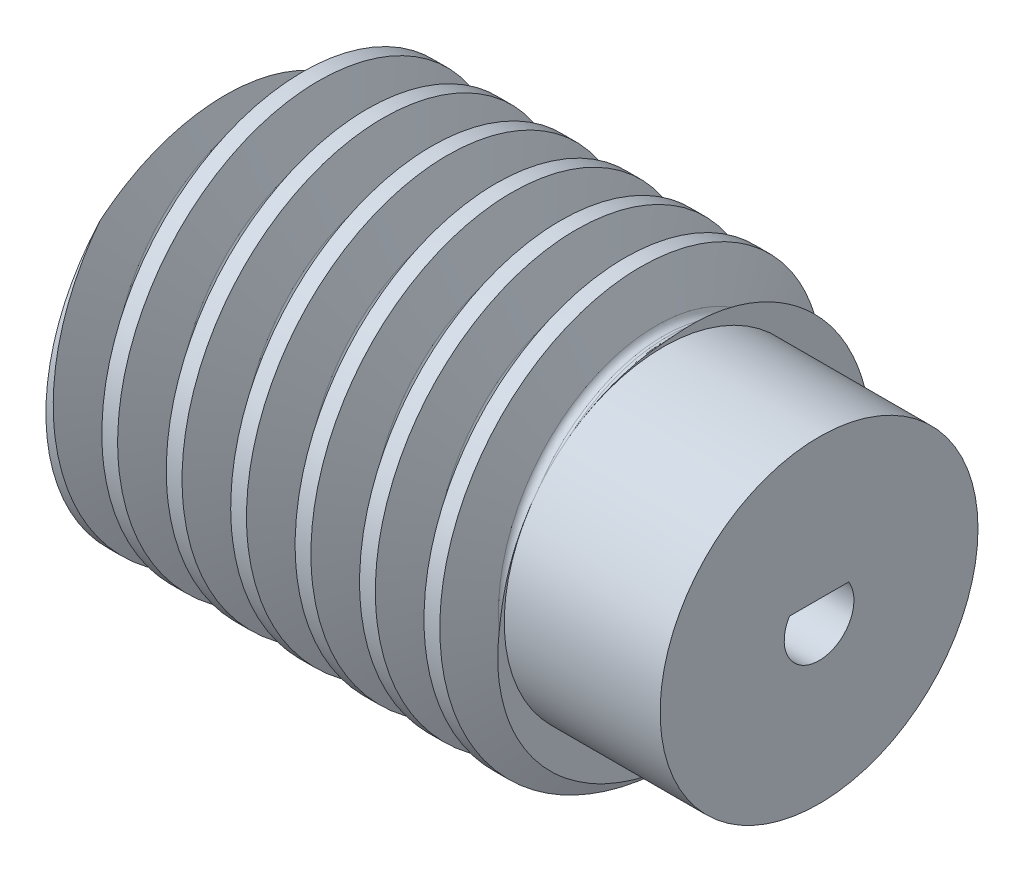
from build123d import *

# Parameters (mm, degrees)
SKETCH_1_W          = 20
SKETCH_1_H          = 10.1
SWEEP_1_PITCH       = 3.141592654
SKETCH_5_R          = 7.75
EXTRUDE_2_DEPTH     = 7.6
CUT_EXTRUDE_1_DEPTH = 20


with BuildPart() as part:
    # 草图1 → 旋转1 (revolve)
    with BuildSketch(Plane.XY, mode=Mode.PRIVATE) as revolve_1_sk:
        with Locations((10, 5.05)):
            Rectangle(SKETCH_1_W, SKETCH_1_H)
    revolve(revolve_1_sk.sketch.rotate(Axis((-56.849408284, 0, 0), (1, 0, 0)), 90), axis=Axis((-56.849408284, 0, 0), (1, 0, 0)))

    # 切除-扫描1: the profile of 草图3 profile screwed along a right-hand helix of 9.676621 turns, 10 arcs to a turn; built about Z, then put on its axis
    sweep_1_z = Axis((0, 0, 0), (0, 0, 1))
    sweep_1_corners = [(10.1003, 0, -3.557405454), (10.1003, 0, -1.18565623), (8.000032346, 0, -1.95009114), (7.75, 0, -2.307174336), (7.75, 0, -2.435887348), (8.000032346, 0, -2.792970544)]
    with BuildLine(mode=Mode.PRIVATE) as sweep_1_profile:
        Line(sweep_1_corners[0], sweep_1_corners[1])
        Line(sweep_1_corners[1], sweep_1_corners[2])
        Line(sweep_1_corners[3], sweep_1_corners[4])
        Line(sweep_1_corners[5], sweep_1_corners[0])
        ThreePointArc((8.000032346, 0, -1.95009114), (7.818722223, 0, -2.08921529), (7.75, 0, -2.307174336))
        ThreePointArc((7.75, 0, -2.435887348), (7.818722223, 0, -2.653846394), (8.000032346, 0, -2.792970544))
    sweep_1_cap = Face(sweep_1_profile.wire())
    sweep_1_arcs = [((8.000032346, 0, -1.95009114), (7.75, 0, -2.041095472), (7.75, 0, -2.307174336), (1, 0.8191520442889907, 1)), ((7.75, 0, -2.435887348), (7.75, 0, -2.701966213), (8.000032346, 0, -2.792970544), (1, 0.8191520442889931, 1))]  # start, shoulder, end, weights
    sweep_1_turn_angles = [0, 18, 36, 54, 72, 90, 108, 126, 144, 162, 180, 198, 216, 234, 252, 270, 288, 306, 324, 342, 360]
    sweep_1_turn_weights = [1, 0.9510565162951535, 1, 0.9510565162951535, 1, 0.9510565162951535, 1, 0.9510565162951535, 1, 0.9510565162951535, 1, 0.9510565162951535, 1, 0.9510565162951535, 1, 0.9510565162951535, 1, 0.9510565162951535, 1, 0.9510565162951535, 1]
    sweep_1_turn_rails = [Edge.make_bspline([Vector(p[0], p[1], 0).rotate(sweep_1_z, sweep_1_turn_angles[k]) / sweep_1_turn_weights[k] + Vector(0, 0, p[2] + SWEEP_1_PITCH * sweep_1_turn_angles[k] / 360) for k in range(21)], [0, 0, 0, 1, 1, 2, 2, 3, 3, 4, 4, 5, 5, 6, 6, 7, 7, 8, 8, 9, 9, 10, 10, 10], 2, sweep_1_turn_weights) for p in sweep_1_corners]
    sweep_1_turn_sides = [*[Face.make_surface_from_curves(sweep_1_turn_rails[p[0]], sweep_1_turn_rails[p[1]]) for p in [(0, 1), (1, 2), (3, 4), (5, 0)]], *[Face.make_bezier_surface([[Vector(p[j][0], p[j][1], 0).rotate(sweep_1_z, sweep_1_turn_angles[2 * i + k]) / sweep_1_turn_weights[2 * i + k] + Vector(0, 0, p[j][2] + SWEEP_1_PITCH * sweep_1_turn_angles[2 * i + k] / 360) for k in range(3)] for j in range(3)], [[p[3][j] * sweep_1_turn_weights[2 * i + k] for k in range(3)] for j in range(3)]) for p in sweep_1_arcs for i in range(10)]]
    sweep_1_last_angles = [3240, 3258, 3276, 3294, 3312, 3330, 3348, 3366, 3384, 3402, 3420, 3438, 3456, 3469.791697198, 3483.583394395]
    sweep_1_last_weights = [1, 0.9510565162951535, 1, 0.9510565162951535, 1, 0.9510565162951535, 1, 0.9510565162951535, 1, 0.9510565162951535, 1, 0.9510565162951535, 1, 0.9711688358913783, 1]
    sweep_1_last_rails = [Edge.make_bspline([Vector(p[0], p[1], 0).rotate(sweep_1_z, sweep_1_last_angles[k]) / sweep_1_last_weights[k] + Vector(0, 0, p[2] + SWEEP_1_PITCH * sweep_1_last_angles[k] / 360) for k in range(15)], [0, 0, 0, 1, 1, 2, 2, 3, 3, 4, 4, 5, 5, 6, 6, 7, 7, 7], 2, sweep_1_last_weights) for p in sweep_1_corners]
    sweep_1_last_sides = [*[Face.make_surface_from_curves(sweep_1_last_rails[p[0]], sweep_1_last_rails[p[1]]) for p in [(0, 1), (1, 2), (3, 4), (5, 0)]], *[Face.make_bezier_surface([[Vector(p[j][0], p[j][1], 0).rotate(sweep_1_z, sweep_1_last_angles[2 * i + k]) / sweep_1_last_weights[2 * i + k] + Vector(0, 0, p[j][2] + SWEEP_1_PITCH * sweep_1_last_angles[2 * i + k] / 360) for k in range(3)] for j in range(3)], [[p[3][j] * sweep_1_last_weights[2 * i + k] for k in range(3)] for j in range(3)]) for p in sweep_1_arcs for i in range(7)]]
    sweep_1 = Plane(origin=(0, 0, 0), x_dir=(0, 1, 0), z_dir=(1, 0, 0)) * Solid(Shell([*[p.moved(Location((0, 0, SWEEP_1_PITCH * i))) for i in range(9) for p in sweep_1_turn_sides], *sweep_1_last_sides, sweep_1_cap, sweep_1_cap.rotate(sweep_1_z, 3483.583394395).moved(Location((0, 0, SWEEP_1_PITCH * 3483.583394395 / 360)))]))
    add(sweep_1, mode=Mode.SUBTRACT)

    # 草图5 → 凸台-拉伸2 (add)
    with BuildSketch(Plane(origin=(20, 0, 0), x_dir=(0, 0, -1), z_dir=(1, 0, 0))):
        with Locations(Location((0, 0, 0), (0, 0, 141.011660332))):
            Circle(SKETCH_5_R)
    extrude(amount=EXTRUDE_2_DEPTH)

    # 草图6 → 切除-拉伸1 (cut)
    with BuildSketch(Plane(origin=(27.6, 0, 0), x_dir=(0, 0, -1), z_dir=(1, 0, 0))):
        with BuildLine():
            Line((-1.44222051, 0.9), (1.44222051, 0.9))
            ThreePointArc((1.44222051, 0.9), (0, -1.7), (-1.44222051, 0.9))
        make_face()
    extrude(amount=-CUT_EXTRUDE_1_DEPTH, mode=Mode.SUBTRACT)


solid = part.part
